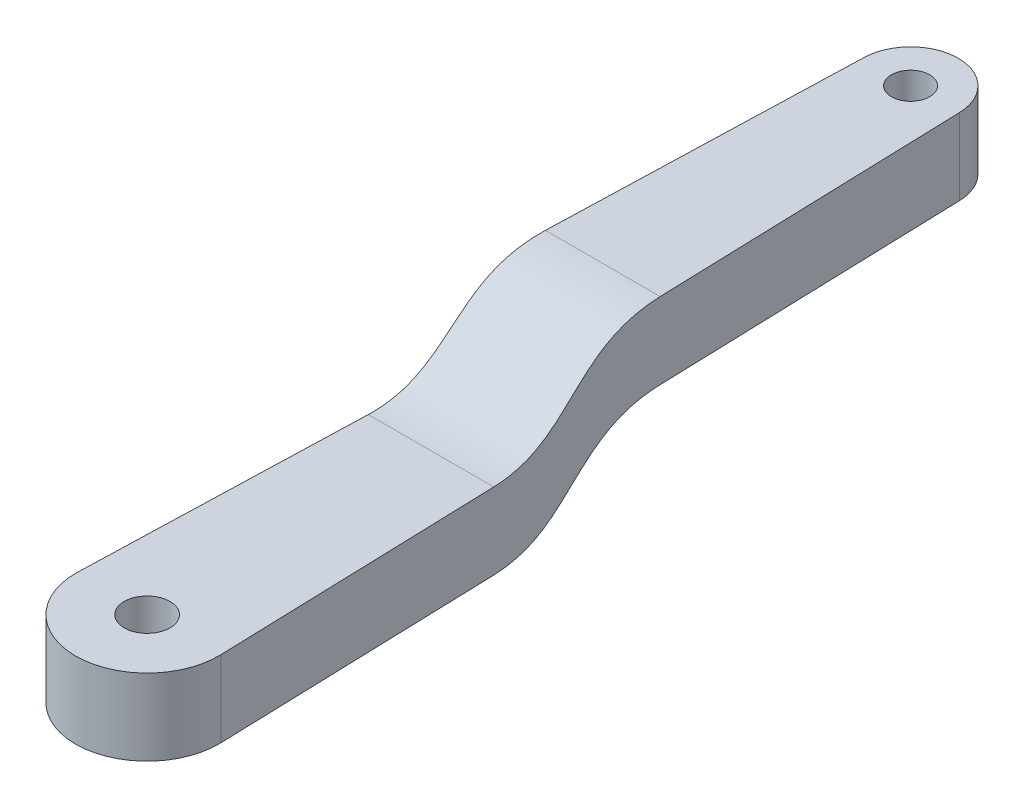
from build123d import *

# Parameters (mm, degrees)
SKETCH1_R               = 1.2
SKETCH1_R_2             = 1
BOSS_EXTRUDE1_DEPTH     = 8
CUT_EXTRUDE7_DEPTH      = 44.408668489
CUT_EXTRUDE7_DEPTH_BACK = 44.408668489


with BuildPart() as part:
    # Sketch1 → Boss-Extrude1 (new body)
    with BuildSketch(Plane(origin=(0, 0, 0), x_dir=(1, 0, 0), z_dir=(0, 1, 0))):
        with BuildLine():
            Line((3.748168498, 0.1171875), (2.498778999, 40.078125))
            ThreePointArc((2.498778999, 40.078125), (0, 42.5), (-2.498778999, 40.078125))
            Line((-2.498778999, 40.078125), (-3.748168498, 0.1171875))
            ThreePointArc((-3.748168498, 0.1171875), (0, -3.75), (3.748168498, 0.1171875))
        make_face()
        Circle(SKETCH1_R, mode=Mode.SUBTRACT)
        with Locations((0, 40)):
            Circle(SKETCH1_R_2, mode=Mode.SUBTRACT)
    extrude(amount=BOSS_EXTRUDE1_DEPTH)

    # Sketch4 → Cut-Extrude7 (cut, two sides: drawn at the far end of the back side and taken through both)
    with BuildSketch(Plane(origin=(0, 0, 0), x_dir=(0, 0, -1), z_dir=(1, 0, 0)).offset(-CUT_EXTRUDE7_DEPTH_BACK)):
        with BuildLine():
            Line((42.5, 4), (23.875, 4))
            add(Edge.make_bspline(
                [(14.875, 0), (19.125, 0), (19.123406576, 3.999999238), (23.875, 4)],
                knots=[0, 0, 0, 0, 1, 1, 1, 1], degree=3))
            ThreePointArc((14.875, 0), (31.025432495, -14.146346291), (42.5, 4))
        make_face()
        with BuildLine():
            Line((14.875, 4), (-3.75, 4))
            ThreePointArc((-3.75, 4), (8.0625, 19.8125), (23.875, 8))
            add(Edge.make_bspline(
                [(14.875, 4), (19.125, 4), (19.123406576, 7.999999238), (23.875, 8)],
                knots=[0, 0, 0, 0, 1, 1, 1, 1], degree=3))
        make_face()
    extrude(amount=CUT_EXTRUDE7_DEPTH + CUT_EXTRUDE7_DEPTH_BACK, mode=Mode.SUBTRACT)


solid = part.part
